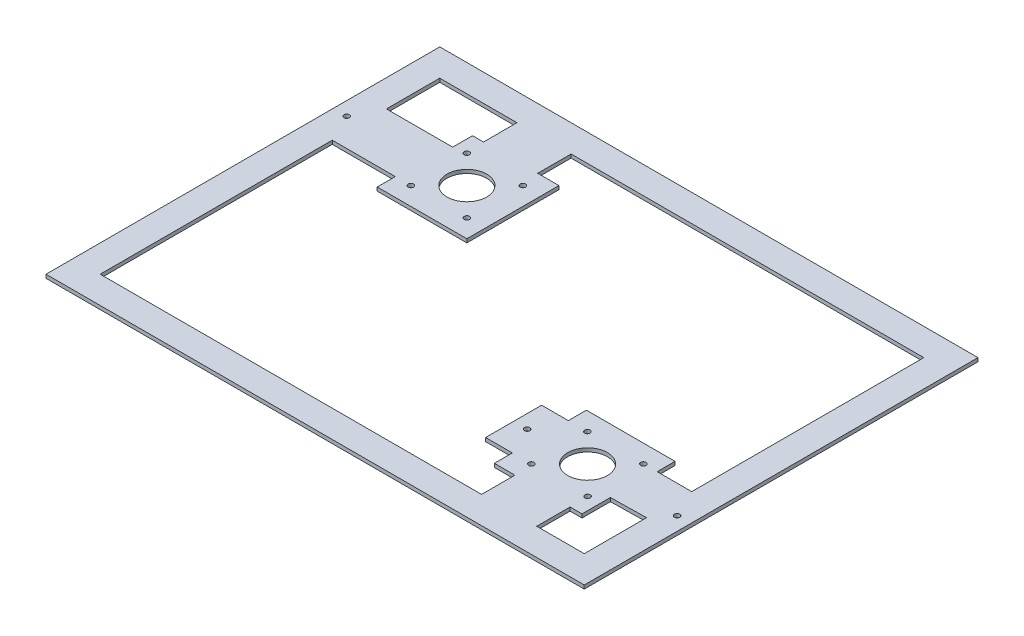
from build123d import *

# Parameters (mm, degrees)
SKETCH1_W           = 218
SKETCH1_H           = 2
BOSS_EXTRUDE1_DEPTH = 298
SKETCH2_R           = 11
SKETCH2_R_2         = 1.5
CUT_EXTRUDE1_DEPTH  = 10


with BuildPart() as part:
    # Sketch1 → Boss-Extrude1 (new body)
    with BuildSketch(Plane(origin=(0, 0, 0), x_dir=(0, 0, -1), z_dir=(1, 0, 0))):
        with Locations((82.3216851, 1)):
            Rectangle(SKETCH1_W, SKETCH1_H)
    extrude(amount=BOSS_EXTRUDE1_DEPTH)

    # Sketch2 → Cut-Extrude1 (cut)
    with BuildSketch(Plane(origin=(0, 2, 0), x_dir=(1, 0, 0), z_dir=(0, 1, 0))):
        with Locations((74, 132.3216851)):
            Circle(SKETCH2_R)
        with Locations((89.5, 116.8216851)):
            Circle(SKETCH2_R_2)
        with Locations((58.5, 116.8216851)):
            Circle(SKETCH2_R_2)
        with Locations((89.5, 147.8216851)):
            Circle(SKETCH2_R_2)
        with Locations((58.5, 147.8216851)):
            Circle(SKETCH2_R_2)
        with Locations((256.33130124, 47.719426297)):
            Circle(SKETCH2_R_2)
        with Locations((256.457517214, 16.719426297)):
            Circle(SKETCH2_R_2)
        with Locations((225.33130124, 16.719426297)):
            Circle(SKETCH2_R_2)
        with Locations((225.33130124, 47.719426297)):
            Circle(SKETCH2_R_2)
        with Locations((240.957517214, 32.219426297)):
            Circle(SKETCH2_R)
        with Locations((290.5, 32.219426297)):
            Circle(SKETCH2_R_2)
        with Locations((7.5, 132.3216851)):
            Circle(SKETCH2_R_2)
        with Locations((207.490401532, 32.219426297)):
            Circle(SKETCH2_R_2)
        Polygon((15, 176.3216851), (57.721228679, 176.3216851), (57.721228679, 157.8216851), (51.65209525, 157.8216851), (51.65209525, 146.8216851), (15, 146.8216851), (15, 159.517007057), align=None)
        Polygon((149, -11.6783149), (104.471210326, -11.6783149), (15, -11.6783149), (15, 89.941809838), (15, 116.8216851), (49.873323929, 116.8216851), (49.873323929, 106.8216851), (99.5, 106.8216851), (99.5, 157.8216851), (87.721228679, 157.8216851), (87.721228679, 176.3216851), (101.200621078, 176.3216851), (149, 176.3216851), (283, 176.3216851), (283, 47.8216851), (263.876177895, 47.8216851), (263.876177895, 57.719426297), (214.790401532, 57.719426297), (214.790401532, 47.719426297), (199.990401532, 47.719426297), (199.990401532, 16.719426297), (214.790401532, 16.719426297), (214.790401532, 6.77711424), (226.154489119, 6.77711424), (226.154489119, -11.6783149), align=None)
        Polygon((283, -11.6783149), (283, 10.126363143), (283, 22.8216851), (263.305421964, 22.488619524), (263.305421964, 6.7816851), (256.695388827, 6.7816851), (256.695388827, -11.6783149), align=None)
    extrude(amount=-CUT_EXTRUDE1_DEPTH, mode=Mode.SUBTRACT)


solid = part.part
